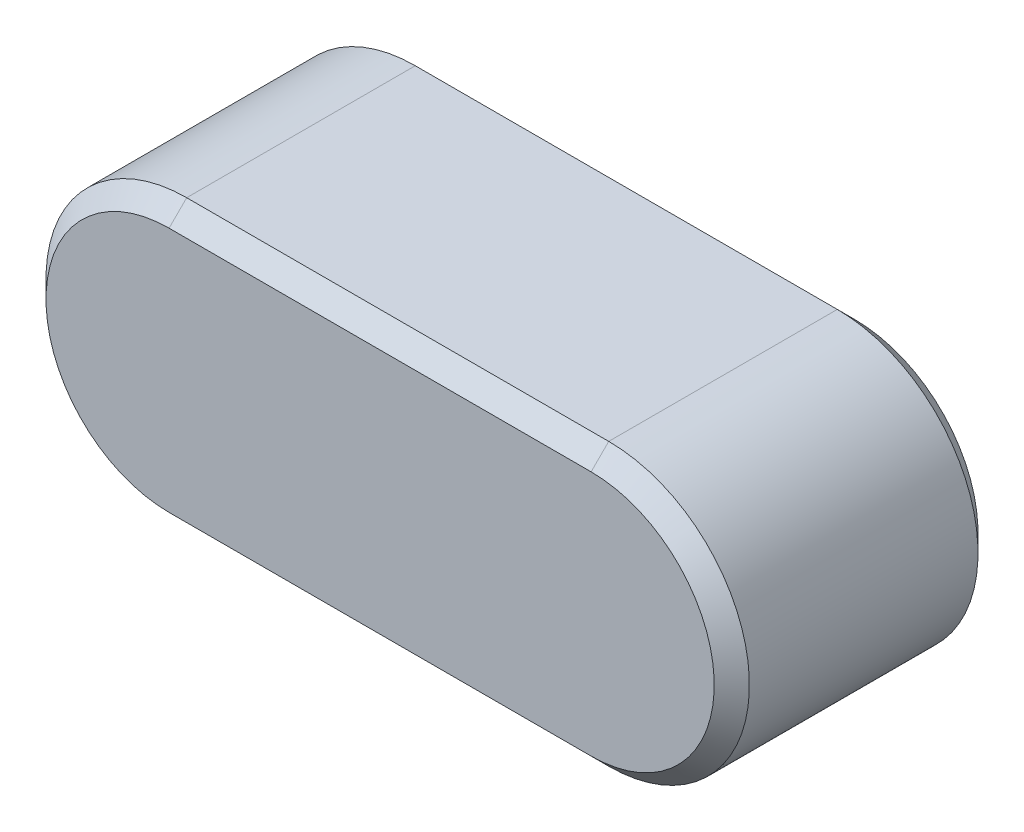
from build123d import *

# Parameters (mm, degrees)
BOSS_EXTRU_1_DEPTH = 7.5
CHANFREIN1_SIZE    = 0.5


with BuildPart() as part:
    # Esquisse1 → Boss.-Extru.1 (new body)
    with BuildSketch(Plane.XY):
        with BuildLine():
            Line((-23.840964093, 4), (-11.840964093, 4))
            ThreePointArc((-11.840964093, 4), (-7.840964093, 0), (-11.840964093, -4))
            Line((-11.840964093, -4), (-23.840964093, -4))
            ThreePointArc((-23.840964093, -4), (-27.840964093, 0), (-23.840964093, 4))
        make_face()
    extrude(amount=BOSS_EXTRU_1_DEPTH)

    # Chanfrein1
    chanfrein1_edges = [part.edges().sort_by_distance(p)[0] for p in [
        (-17.840964093, -4, 7.5),
        (-7.840964093, 0, 7.5),
        (-27.840964093, 0, 7.5),
        (-17.840964093, 4, 7.5),
        (-17.840964093, -4, 0),
        (-7.840964093, 0, 0),
        (-27.840964093, 0, 0),
        (-17.840964093, 4, 0),
    ]]
    chamfer(chanfrein1_edges, length=CHANFREIN1_SIZE)


solid = part.part
